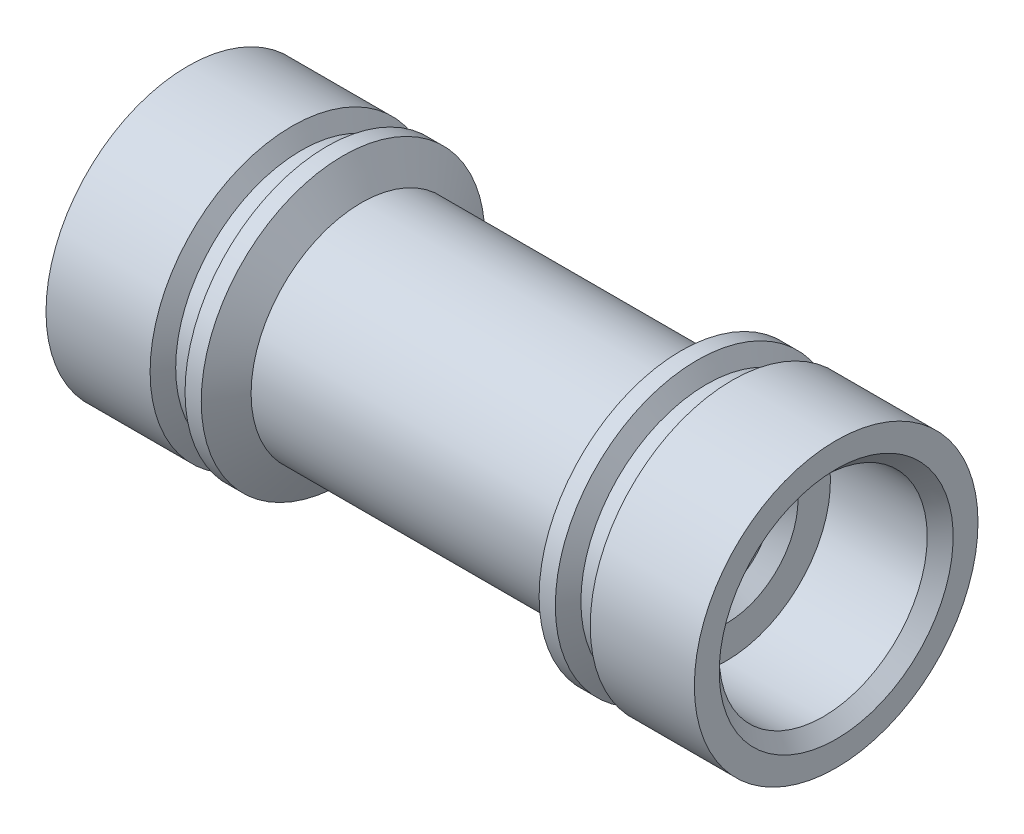
from build123d import *

# Parameters (mm, degrees)
CHAMFER1_SIZE = 0.508


with BuildPart() as part:
    # Sketch2 → Revolve1 (revolve)
    with BuildSketch(Plane.XY):
        Polygon((-8.621617421, 5.55625), (-12.7, 5.55625), (-12.7, 4.075), (-8.399999964, 4.075), (-8.399999964, 2.805), (-7.891999964, 2.297), (-7.891999964, 1.905), (-2.748, 1.905), (-0.843, 0), (0, 0), (0, 4.318), (-5.903478608, 4.318), (-6.618382579, 5.55625), (-7.253382579, 5.55625), (-7.62, 4.92125), (-8.255, 4.92125), align=None)
    revolve(axis=Axis((-12.7, 0, 0), (1, 0, 0)))

    # Chamfer1
    chamfer1_edges = [part.edges().sort_by_distance(p)[0] for p in [
        (-12.7, -4.075, 0),
    ]]
    chamfer(chamfer1_edges, length=CHAMFER1_SIZE)

    # Mirror1: part across plane


with BuildPart() as part_1:
    add(part.part)
    add(part.part.mirror(Plane(origin=(0, 0, 0), x_dir=(0, 0, 1), z_dir=(1, 0, 0))))


solid = part_1.part
